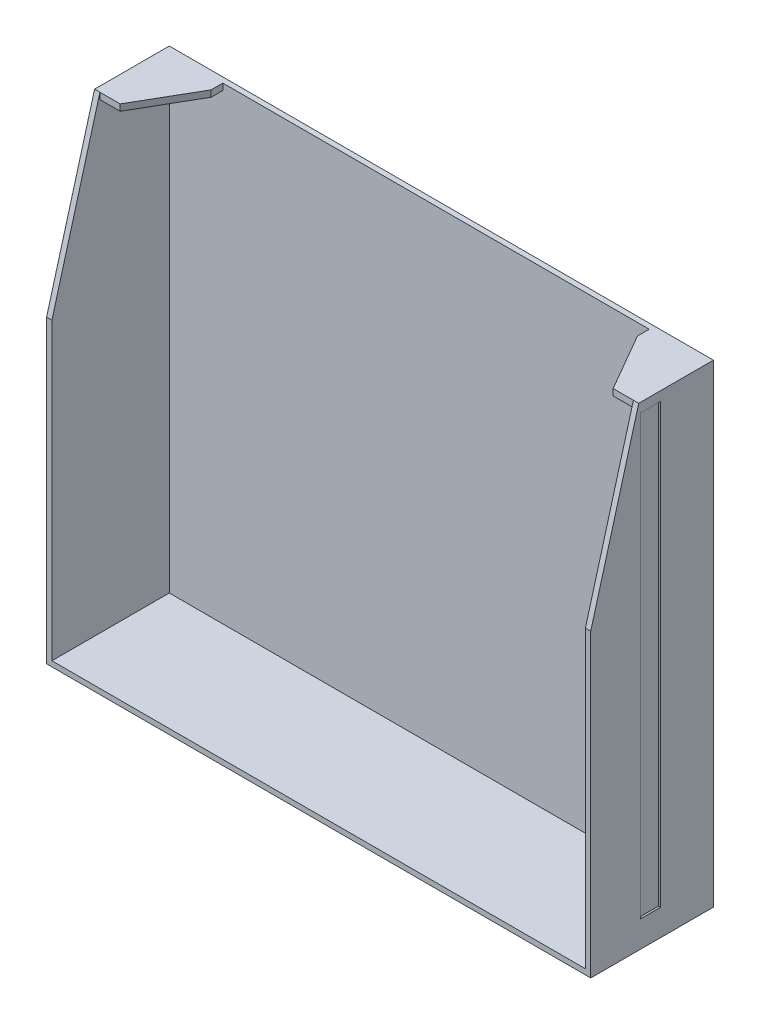
from build123d import *

# Parameters (mm, degrees)
SKETCH1_W                               = 255
SKETCH1_H                               = 222
BOSS_EXTRUDE1_DEPTH                     = 2.5
SKETCH2_W                               = 2.5
SKETCH2_H                               = 222
SKETCH2_W_2                             = 250
SKETCH2_H_2                             = 2.5
BOSS_EXTRUDE2_DEPTH                     = 55
HOLD_TAB_DEPTH                          = 3
FRONT_TAPER_DEPTH                       = 178.770216853
FRONT_TAPER_DEPTH_BACK                  = 178.770216853
SKETCH6_W                               = 8.4
SKETCH6_H                               = 204.4
MOUNTING_POCKET_DEPTH                   = 284.048140782
PRINT_CHAMFERS_SIZE                     = 0.5
PRINT_CHAMFERS_OF_MOUNTING_POCKETS_SIZE = 0.5


with BuildPart() as part:
    # Sketch1 → Boss-Extrude1 (new body)
    with BuildSketch(Plane.XY):
        Rectangle(SKETCH1_W, SKETCH1_H)
    extrude(amount=-BOSS_EXTRUDE1_DEPTH)

    # Sketch2 → Boss-Extrude2 (add)
    with BuildSketch(Plane.XY):
        with Locations((-126.25, 0)):
            Rectangle(SKETCH2_W, SKETCH2_H)
        with Locations((0, -109.75)):
            Rectangle(SKETCH2_W_2, SKETCH2_H_2)
        with Locations((126.25, 0)):
            Rectangle(SKETCH2_W, SKETCH2_H)
    extrude(amount=BOSS_EXTRUDE2_DEPTH)

    # Sketch4 → Hold Tab (add)
    with BuildSketch(Plane(origin=(0, 111, 0), x_dir=(1, 0, 0), z_dir=(0, 1, 0))):
        Polygon((127.5, 2.5), (127.5, -32.5), (115.5, -32.5), (99.911542732, -5.5), (99.911542732, 2.5), align=None)
    hold_tab = extrude(amount=-HOLD_TAB_DEPTH)

    # Hold Tabs: Hold Tab across plane
    add(hold_tab.mirror(Plane(origin=(0, 0, 0), x_dir=(0, 0, 1), z_dir=(1, 0, 0))))

    # Sketch5 → Front Taper (cut, two sides: drawn at the far end of the back side and taken through both)
    with BuildSketch(Plane(origin=(0, 0, 0), x_dir=(0, 0, -1), z_dir=(1, 0, 0)).offset(-FRONT_TAPER_DEPTH_BACK)):
        Polygon((-55, 29.727996643), (-32.5, 111), (-55, 111), align=None)
    extrude(amount=FRONT_TAPER_DEPTH + FRONT_TAPER_DEPTH_BACK, mode=Mode.SUBTRACT)

    # Sketch6 → Mounting Pocket (cut, through all)
    with BuildSketch(Plane.ZY.offset(-127)):
        with Locations((27, 4)):
            Rectangle(SKETCH6_W, SKETCH6_H)
    mounting_pocket = extrude(amount=-MOUNTING_POCKET_DEPTH, mode=Mode.SUBTRACT)

    # Print Chamfers
    print_chamfers_edges = [part.edges().sort_by_distance(p)[0] for p in [
        (127.5, 106.2, 27),
        (127.5, 4, 22.8),
        (127.5, -98.2, 27),
        (127.5, 4, 31.2),
    ]]
    chamfer(print_chamfers_edges, length=PRINT_CHAMFERS_SIZE - 0.0001)  # a hair under: the kernel refuses the full size

    # Mounting Pockets: Mounting Pocket across plane
    add(mounting_pocket.mirror(Plane(origin=(0, 0, 0), x_dir=(0, 0, 1), z_dir=(1, 0, 0))), mode=Mode.SUBTRACT)

    # Print Chamfers of Mounting Pockets
    print_chamfers_of_mounting_pockets_edges = [part.edges().sort_by_distance(p)[0] for p in [
        (-127.5, 106.2, 27),
        (-127.5, 4, 22.8),
        (-127.5, -98.2, 27),
        (-127.5, 4, 31.2),
    ]]
    chamfer(print_chamfers_of_mounting_pockets_edges, length=PRINT_CHAMFERS_OF_MOUNTING_POCKETS_SIZE - 0.0001)  # a hair under: the kernel refuses the full size


solid = part.part
